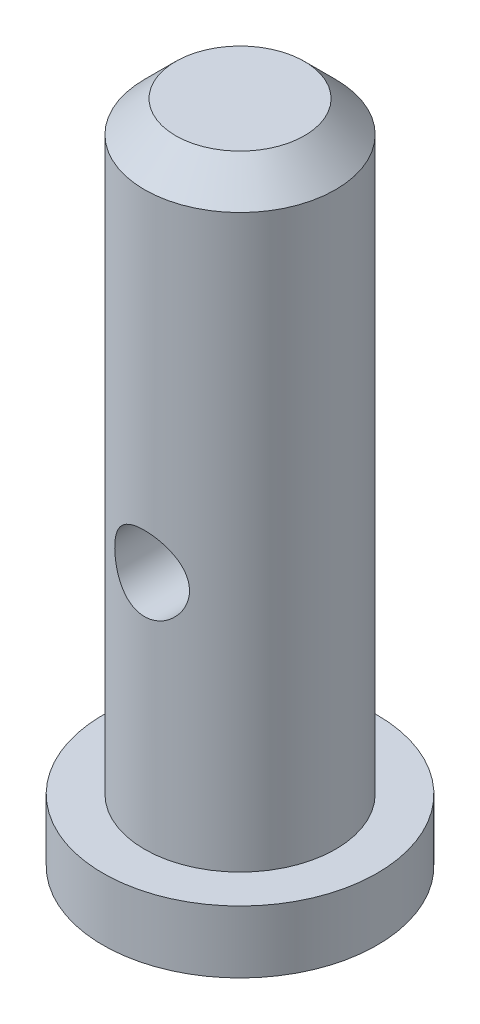
from build123d import *

# Parameters (mm, degrees)
CHAMFER1_SIZE           = 0.75
CUT_EXTRUDE1_DEPTH      = 17.666733333
CUT_EXTRUDE1_DEPTH_BACK = 17.666733333
SKETCH2_R               = 0.9


with BuildPart() as part:
    # Sketch1 → Revolve1 (revolve)
    with BuildSketch(Plane.XY):
        Polygon((0, 16), (2.3, 16), (2.3, 1.5), (3.3, 1.5), (3.3, 0), (0, 0), align=None)
    revolve(axis=Axis((0, 0, 0), (0, 1, 0)))

    # Chamfer1
    chamfer1_edges = [part.edges().sort_by_distance(p)[0] for p in [
        (-2.3, 16, 0),
    ]]
    chamfer(chamfer1_edges, length=CHAMFER1_SIZE)

    # Sketch2 → Cut-Extrude1 (cut, two sides: drawn at the far end of the back side and taken through both)
    with BuildSketch(Plane.XY.offset(-CUT_EXTRUDE1_DEPTH_BACK)):
        with Locations((0, 7.25)):
            Circle(SKETCH2_R)
    extrude(amount=CUT_EXTRUDE1_DEPTH + CUT_EXTRUDE1_DEPTH_BACK, mode=Mode.SUBTRACT)


solid = part.part
